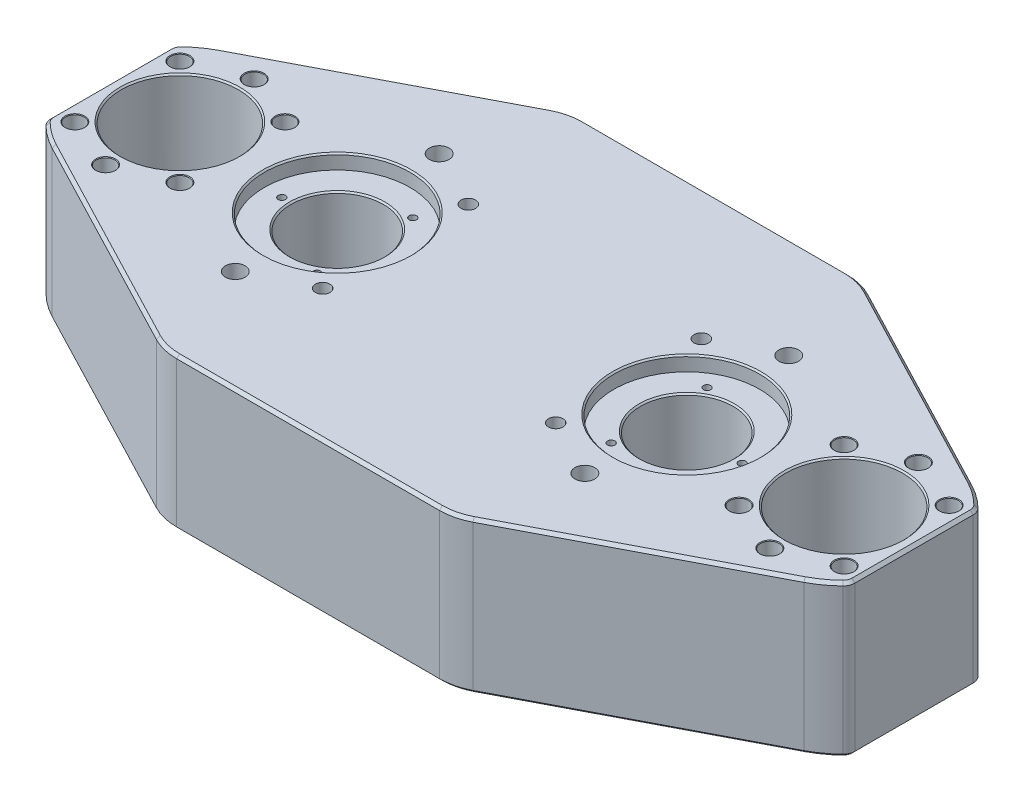
from build123d import *

# Parameters (mm, degrees)
SKETCH1_R                      = 20.1
SKETCH1_R_2                    = 15.875
BOSS_EXTRUDE1_DEPTH            = 26
M6_CLEARANCE_HOLE1_D           = 6.4
CHAMFER2_SIZE                  = 0.5
CHAMFER5_SIZE                  = 1
CHAMFER6_SIZE                  = 0.5
M3X0_5_TAPPED_HOLE1_AT_2_COUNT = 2
M3X0_5_TAPPED_HOLE1_AT_2_PITCH = 32.908965344
M3X0_5_TAPPED_HOLE1_AT_3_COUNT = 2
M3X0_5_TAPPED_HOLE1_AT_3_PITCH = 32.908965344
CHAMFER9_SIZE                  = 0.2
M8X1_25_TAPPED_HOLE1_D         = 6.8
MIRROR9_COPY_1_D               = 6.8
MIRROR9_COPY_2_D               = 6.8
SKETCH17_R                     = 25
CUT_EXTRUDE1_DEPTH             = 5
CHAMFER10_SIZE                 = 0.5
M6X1_0_TAPPED_HOLE1_AT_2_COUNT = 2
M6X1_0_TAPPED_HOLE1_AT_2_PITCH = 50
M6X1_0_TAPPED_HOLE1_AT_3_COUNT = 2
M6X1_0_TAPPED_HOLE1_AT_3_PITCH = 80
M6X1_0_TAPPED_HOLE1_AT_4_COUNT = 2
M6X1_0_TAPPED_HOLE1_AT_4_PITCH = 94.339811321


with BuildPart() as part:
    # Sketch1 → Boss-Extrude1 (new, symmetric)
    with BuildSketch(Plane(origin=(0, 0, 0), x_dir=(1, 0, 0), z_dir=(0, 1, 0))):
        with BuildLine():
            Line((-129.019397533, 28.821306316), (-54.344115966, 67.736188502))
            ThreePointArc((-54.344115966, 67.736188502), (-49.859362606, 69.425804617), (-45.101409792, 70))
            Line((-45.101409792, 70), (45.101409792, 70))
            ThreePointArc((45.101409792, 70), (49.859362606, 69.425804617), (54.344115966, 67.736188502))
            Line((54.344115966, 67.736188502), (129.019397533, 28.821306316))
            ThreePointArc((129.019397533, 28.821306316), (133.124332583, 26.277555123), (136.807017544, 23.153616364))
            ThreePointArc((136.807017544, 23.153616364), (137.689720191, 21.848597396), (138, 20.303940504))
            Line((138, 20.303940504), (138, -20.303940504))
            ThreePointArc((138, -20.303940504), (137.689720191, -21.848597396), (136.807017544, -23.153616364))
            ThreePointArc((136.807017544, -23.153616364), (133.124332583, -26.277555123), (129.019397533, -28.821306316))
            Line((129.019397533, -28.821306316), (54.344115966, -67.736188502))
            ThreePointArc((54.344115966, -67.736188502), (49.859362606, -69.425804617), (45.101409792, -70))
            Line((45.101409792, -70), (-45.101409792, -70))
            ThreePointArc((-45.101409792, -70), (-49.859362606, -69.425804617), (-54.344115966, -67.736188502))
            Line((-54.344115966, -67.736188502), (-129.019397533, -28.821306316))
            ThreePointArc((-129.019397533, -28.821306316), (-133.124332583, -26.277555123), (-136.807017544, -23.153616364))
            ThreePointArc((-136.807017544, -23.153616364), (-137.689720191, -21.848597396), (-138, -20.303940504))
            Line((-138, -20.303940504), (-138, 20.303940504))
            ThreePointArc((-138, 20.303940504), (-137.689720191, 21.848597396), (-136.807017544, 23.153616364))
            ThreePointArc((-136.807017544, 23.153616364), (-133.124332583, 26.277555123), (-129.019397533, 28.821306316))
        make_face()
        with Locations((-114, 0)):
            Circle(SKETCH1_R, mode=Mode.SUBTRACT)
        with Locations((114, 0)):
            Circle(SKETCH1_R, mode=Mode.SUBTRACT)
        with Locations((-60, 0)):
            Circle(SKETCH1_R_2, mode=Mode.SUBTRACT)
        with Locations((60, 0)):
            Circle(SKETCH1_R_2, mode=Mode.SUBTRACT)
    extrude(amount=BOSS_EXTRUDE1_DEPTH, both=True)

    # M6 Clearance Hole1 (through all)
    with Locations(Plane(origin=(0, -26, 0), x_dir=(-1, 0, 0), z_dir=(0, -1, 0))):
        with Locations((-95.96877708, -18.03122292), (-114, -25.5), (-132.03122292, -18.03122292), (-132.03122292, 18.03122292), (-114, 25.5), (-95.96877708, 18.03122292)):
            m6_clearance_hole1 = Hole(M6_CLEARANCE_HOLE1_D / 2)

    # Mirror5: M6 Clearance Hole1 across plane
    add(m6_clearance_hole1.mirror(Plane(origin=(0, 0, 0), x_dir=(0, 0, 1), z_dir=(1, 0, 0))), mode=Mode.SUBTRACT)

    # Chamfer2
    chamfer2_edges = [part.edges().sort_by_distance(p)[0] for p in [
        (93.9, 26, 0),
        (93.9, -26, 0),
        (-134.1, -26, 0),
        (-134.1, 26, 0),
    ]]
    chamfer(chamfer2_edges, length=CHAMFER2_SIZE)

    # Chamfer5
    chamfer5_edges = [part.edges().sort_by_distance(p)[0] for p in [
        (91.68175675, -26, -48.278747409),
        (-91.68175675, -26, -48.278747409),
        (49.859362606, -26, -69.425804617),
        (-49.859362606, -26, -69.425804617),
        (0, -26, -70),
        (-133.124332583, -26, -26.277555123),
        (133.124332583, -26, 26.277555123),
        (-91.68175675, -26, 48.278747409),
        (91.68175675, -26, 48.278747409),
        (-49.859362606, -26, 69.425804617),
        (49.859362606, -26, 69.425804617),
        (0, -26, 70),
        (91.68175675, 26, -48.278747409),
        (-91.68175675, 26, -48.278747409),
        (49.859362606, 26, -69.425804617),
        (-49.859362606, 26, -69.425804617),
        (0, 26, -70),
        (-133.124332583, 26, -26.277555123),
        (133.124332583, 26, 26.277555123),
        (-91.68175675, 26, 48.278747409),
        (91.68175675, 26, 48.278747409),
        (-49.859362606, 26, 69.425804617),
        (49.859362606, 26, 69.425804617),
        (0, 26, 70),
        (133.124332583, -26, -26.277555123),
        (-133.124332583, -26, 26.277555123),
        (133.124332583, 26, -26.277555123),
        (-133.124332583, 26, 26.277555123),
        (-137.689720191, -26, -21.848597396),
        (137.689720191, -26, -21.848597396),
        (-138, -26, 0),
        (138, -26, 0),
        (-137.689720191, -26, 21.848597396),
        (137.689720191, -26, 21.848597396),
        (-137.689720191, 26, -21.848597396),
        (137.689720191, 26, -21.848597396),
        (-138, 26, 0),
        (138, 26, 0),
        (-137.689720191, 26, 21.848597396),
        (137.689720191, 26, 21.848597396),
    ]]
    chamfer(chamfer5_edges, length=CHAMFER5_SIZE)

    # Chamfer6
    chamfer6_edges = [part.edges().sort_by_distance(p)[0] for p in [
        (44.125, -26, 0),
        (44.125, 26, 0),
        (-75.875, -26, 0),
        (-75.875, 26, 0),
    ]]
    chamfer(chamfer6_edges, length=CHAMFER6_SIZE)

    # Sketch13 → M3x0.5 Tapped Hole1 (revolve, cut)
    with BuildSketch(Plane(origin=(79, 26, 0), x_dir=(0, 0, 1), z_dir=(1, 0, 0))):
        Polygon((0, 0), (0, 12.751075774), (1.25, 12), (1.25, 0), align=None)
    m3x0_5_tapped_hole1 = revolve(axis=Axis((79, 32.35, 0), (0, -1, 0)), mode=Mode.SUBTRACT)

    # M3x0.5 Tapped Hole1 at 2: M3x0.5 Tapped Hole1 ×2
    with Locations(*[Vector(-0.8660254037844387, 0, 0.5000000000000001) * (i * M3X0_5_TAPPED_HOLE1_AT_2_PITCH) for i in range(1, M3X0_5_TAPPED_HOLE1_AT_2_COUNT)]):
        add(m3x0_5_tapped_hole1, mode=Mode.SUBTRACT)

    # M3x0.5 Tapped Hole1 at 3: M3x0.5 Tapped Hole1 ×2
    with Locations(*[Vector(-0.8660254037844387, 0, -0.5000000000000001) * (i * M3X0_5_TAPPED_HOLE1_AT_3_PITCH) for i in range(1, M3X0_5_TAPPED_HOLE1_AT_3_COUNT)]):
        add(m3x0_5_tapped_hole1, mode=Mode.SUBTRACT)

    # Mirror6: M3x0.5 Tapped Hole1 across plane
    add(m3x0_5_tapped_hole1.mirror(Plane(origin=(0, 0, 0), x_dir=(0, 0, 1), z_dir=(1, 0, 0))), mode=Mode.SUBTRACT)

    # Mirror6 copy 1 sketch → Mirror6 copy 1 (revolve, cut)
    with BuildSketch(Plane(origin=(-50.5, 26, 16.454482672), x_dir=(0, 0, 1), z_dir=(-1, 0, 0))):
        Polygon((0, 0), (0, -12.751075774), (1.25, -12), (1.25, 0), align=None)
    revolve(axis=Axis((-50.5, 32.35, 16.454482672), (0, 1, 0)), mode=Mode.SUBTRACT)

    # Mirror6 copy 2 sketch → Mirror6 copy 2 (revolve, cut)
    with BuildSketch(Plane(origin=(-50.5, 26, -16.454482672), x_dir=(0, 0, 1), z_dir=(-1, 0, 0))):
        Polygon((0, 0), (0, -12.751075774), (1.25, -12), (1.25, 0), align=None)
    revolve(axis=Axis((-50.5, 32.35, -16.454482672), (0, 1, 0)), mode=Mode.SUBTRACT)

    # Mirror7 copy 1 sketch → Mirror7 copy 1 (revolve, cut)
    with BuildSketch(Plane(origin=(-79, -26, 0), x_dir=(0, 0, 1), z_dir=(-1, 0, 0))):
        Polygon((0, 0), (0, 12.751075774), (1.25, 12), (1.25, 0), align=None)
    revolve(axis=Axis((-79, -32.35, 0), (0, 1, 0)), mode=Mode.SUBTRACT)

    # Mirror7 copy 2 sketch → Mirror7 copy 2 (revolve, cut)
    with BuildSketch(Plane(origin=(-50.5, -26, 16.454482672), x_dir=(0, 0, 1), z_dir=(-1, 0, 0))):
        Polygon((0, 0), (0, 12.751075774), (1.25, 12), (1.25, 0), align=None)
    revolve(axis=Axis((-50.5, -32.35, 16.454482672), (0, 1, 0)), mode=Mode.SUBTRACT)

    # Mirror7 copy 3 sketch → Mirror7 copy 3 (revolve, cut)
    with BuildSketch(Plane(origin=(-50.5, -26, -16.454482672), x_dir=(0, 0, 1), z_dir=(-1, 0, 0))):
        Polygon((0, 0), (0, 12.751075774), (1.25, 12), (1.25, 0), align=None)
    revolve(axis=Axis((-50.5, -32.35, -16.454482672), (0, 1, 0)), mode=Mode.SUBTRACT)

    # Mirror7 copy 4 sketch → Mirror7 copy 4 (revolve, cut)
    with BuildSketch(Plane(origin=(79, -26, 0), x_dir=(0, 0, 1), z_dir=(1, 0, 0))):
        Polygon((0, 0), (0, -12.751075774), (1.25, -12), (1.25, 0), align=None)
    revolve(axis=Axis((79, -32.35, 0), (0, -1, 0)), mode=Mode.SUBTRACT)

    # Mirror7 copy 5 sketch → Mirror7 copy 5 (revolve, cut)
    with BuildSketch(Plane(origin=(50.5, -26, 16.454482672), x_dir=(0, 0, 1), z_dir=(1, 0, 0))):
        Polygon((0, 0), (0, -12.751075774), (1.25, -12), (1.25, 0), align=None)
    revolve(axis=Axis((50.5, -32.35, 16.454482672), (0, -1, 0)), mode=Mode.SUBTRACT)

    # Mirror7 copy 6 sketch → Mirror7 copy 6 (revolve, cut)
    with BuildSketch(Plane(origin=(50.5, -26, -16.454482672), x_dir=(0, 0, 1), z_dir=(1, 0, 0))):
        Polygon((0, 0), (0, -12.751075774), (1.25, -12), (1.25, 0), align=None)
    revolve(axis=Axis((50.5, -32.35, -16.454482672), (0, -1, 0)), mode=Mode.SUBTRACT)

    # Chamfer9
    chamfer9_edges = [part.edges().sort_by_distance(p)[0] for p in [
        (-128.83122292, -26, -18.03122292),
        (-128.83122292, 26, -18.03122292),
        (-110.8, -26, -25.5),
        (-110.8, 26, -25.5),
        (-92.76877708, -26, -18.03122292),
        (-92.76877708, 26, -18.03122292),
        (-92.76877708, -26, 18.03122292),
        (-92.76877708, 26, 18.03122292),
        (-110.8, -26, 25.5),
        (-110.8, 26, 25.5),
        (-128.83122292, -26, 18.03122292),
        (-128.83122292, 26, 18.03122292),
        (128.83122292, -26, 18.03122292),
        (128.83122292, 26, 18.03122292),
        (110.8, -26, 25.5),
        (110.8, 26, 25.5),
        (92.76877708, -26, 18.03122292),
        (92.76877708, 26, 18.03122292),
        (92.76877708, -26, -18.03122292),
        (92.76877708, 26, -18.03122292),
        (128.83122292, -26, -18.03122292),
        (128.83122292, 26, -18.03122292),
        (110.8, -26, -25.5),
        (110.8, 26, -25.5),
    ]]
    chamfer(chamfer9_edges, length=CHAMFER9_SIZE)

    # M8x1.25 Tapped Hole1 (through all)
    with Locations(Plane.XZ.offset(26)):
        with Locations((-60, -35)):
            m8x1_25_tapped_hole1 = Hole(M8X1_25_TAPPED_HOLE1_D / 2)

    # Mirror8: M8x1.25 Tapped Hole1 across plane
    add(m8x1_25_tapped_hole1.mirror(Plane.XY), mode=Mode.SUBTRACT)

    # Mirror9 copy 1 (through all)
    with Locations(Plane(origin=(0, -26, 0), x_dir=(-1, 0, 0), z_dir=(0, -1, 0))):
        with Locations((-60, -35)):
            Hole(MIRROR9_COPY_1_D / 2)

    # Mirror9 copy 2 (through all)
    with Locations(Plane(origin=(0, -26, 0), x_dir=(-1, 0, 0), z_dir=(0, -1, 0))):
        with Locations((-60, 35)):
            Hole(MIRROR9_COPY_2_D / 2)

    # Sketch17 → Cut-Extrude1 (cut)
    with BuildSketch(Plane(origin=(0, 26, 0), x_dir=(1, 0, 0), z_dir=(0, 1, 0))):
        with Locations((60, 0)):
            Circle(SKETCH17_R)
        with Locations((-60, 0)):
            Circle(SKETCH17_R)
    cut_extrude1 = extrude(amount=-CUT_EXTRUDE1_DEPTH, mode=Mode.SUBTRACT)

    # Mirror10: Cut-Extrude1 across plane
    add(cut_extrude1.mirror(Plane.ZX), mode=Mode.SUBTRACT)

    # Chamfer10
    chamfer10_edges = [part.edges().sort_by_distance(p)[0] for p in [
        (44.125, -21, 0),
        (44.125, 21, 0),
        (-75.875, -21, 0),
        (-75.875, 21, 0),
        (35, -26, 0),
        (-85, -26, 0),
        (35, 26, 0),
        (-85, 26, 0),
    ]]
    chamfer(chamfer10_edges, length=CHAMFER10_SIZE)

    # Sketch20 → M6x1.0 Tapped Hole1 (revolve, cut)
    with BuildSketch(Plane(origin=(-40, -26, -25), x_dir=(0, 0, -1), z_dir=(1, 0, 0))):
        Polygon((0, 0), (0, 16.502151548), (2.5, 15), (2.5, 0), align=None)
    m6x1_0_tapped_hole1 = revolve(axis=Axis((-40, -32.35, -25), (0, 1, 0)), mode=Mode.SUBTRACT)

    # M6x1.0 Tapped Hole1 at 2: M6x1.0 Tapped Hole1 ×2
    with Locations(*[(0, 0, i * M6X1_0_TAPPED_HOLE1_AT_2_PITCH) for i in range(1, M6X1_0_TAPPED_HOLE1_AT_2_COUNT)]):
        add(m6x1_0_tapped_hole1, mode=Mode.SUBTRACT)

    # M6x1.0 Tapped Hole1 at 3: M6x1.0 Tapped Hole1 ×2
    with Locations(*[(i * M6X1_0_TAPPED_HOLE1_AT_3_PITCH, 0, 0) for i in range(1, M6X1_0_TAPPED_HOLE1_AT_3_COUNT)]):
        add(m6x1_0_tapped_hole1, mode=Mode.SUBTRACT)

    # M6x1.0 Tapped Hole1 at 4: M6x1.0 Tapped Hole1 ×2
    with Locations(*[Vector(0.847998304005088, 0, 0.52999894000318) * (i * M6X1_0_TAPPED_HOLE1_AT_4_PITCH) for i in range(1, M6X1_0_TAPPED_HOLE1_AT_4_COUNT)]):
        add(m6x1_0_tapped_hole1, mode=Mode.SUBTRACT)

    # Mirror11: M6x1.0 Tapped Hole1 across plane
    add(m6x1_0_tapped_hole1.mirror(Plane.ZX), mode=Mode.SUBTRACT)

    # Mirror11 copy 1 sketch → Mirror11 copy 1 (revolve, cut)
    with BuildSketch(Plane(origin=(-40, 26, 25), x_dir=(0, 0, -1), z_dir=(1, 0, 0))):
        Polygon((0, 0), (0, -16.502151548), (2.5, -15), (2.5, 0), align=None)
    revolve(axis=Axis((-40, 32.35, 25), (0, 1, 0)), mode=Mode.SUBTRACT)

    # Mirror11 copy 2 sketch → Mirror11 copy 2 (revolve, cut)
    with BuildSketch(Plane(origin=(40, 26, -25), x_dir=(0, 0, -1), z_dir=(1, 0, 0))):
        Polygon((0, 0), (0, -16.502151548), (2.5, -15), (2.5, 0), align=None)
    revolve(axis=Axis((40, 32.35, -25), (0, 1, 0)), mode=Mode.SUBTRACT)

    # Mirror11 copy 3 sketch → Mirror11 copy 3 (revolve, cut)
    with BuildSketch(Plane(origin=(40, 26, 25), x_dir=(0, 0, -1), z_dir=(1, 0, 0))):
        Polygon((0, 0), (0, -16.502151548), (2.5, -15), (2.5, 0), align=None)
    revolve(axis=Axis((40, 32.35, 25), (0, 1, 0)), mode=Mode.SUBTRACT)


solid = part.part
